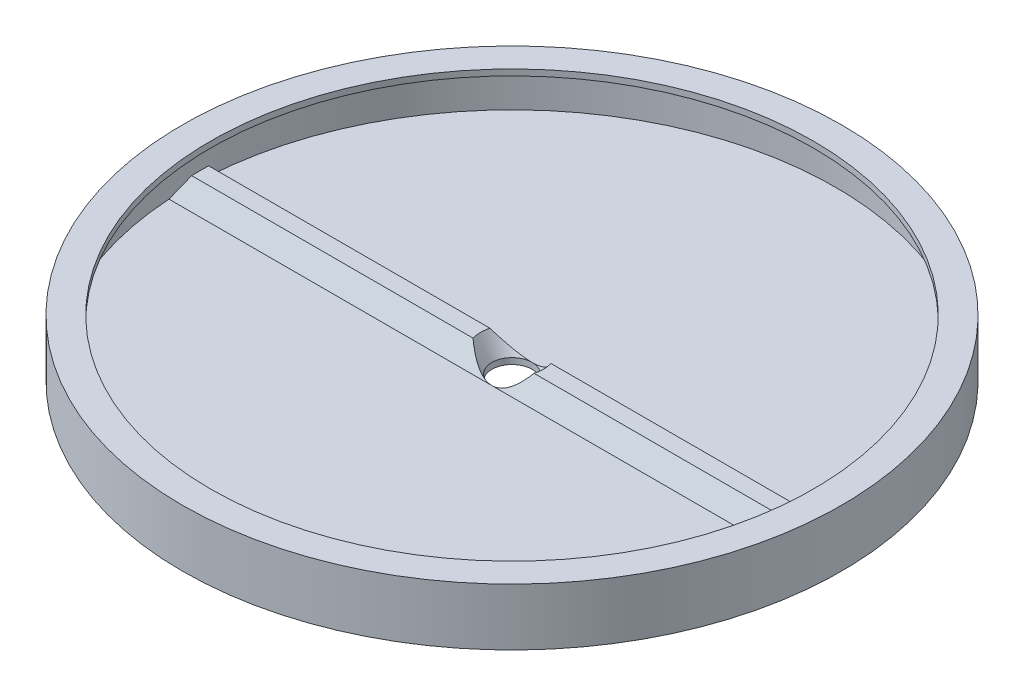
from build123d import *

# Parameters (mm, degrees)
SKETCH2_R             = 80.5
SKETCH2_R_2           = 5
BOSS_EXTRUDE1_DEPTH   = 1.5
BOSS_EXTRUDE3_DEPTH   = 5
BOSS_EXTRUDE3_DRAFT   = 30
BOSS_EXTRUDE3_2_DEPTH = 5
BOSS_EXTRUDE3_2_DRAFT = 30
BOSS_EXTRUDE4_DEPTH   = 7.5
SKETCH8_R             = 2
CUT_EXTRUDE1_DEPTH    = 3


# Read off the part's stored shape, not the designer's step: Boss-Extrude3
with BuildPart() as part:
    # Sketch2 → Boss-Extrude1 (new body)
    with BuildSketch(Plane(origin=(0, 0, 0), x_dir=(1, 0, 0), z_dir=(0, 1, 0))):
        with Locations(Location((0, 0, 0), (0, 0, 270))):
            Circle(SKETCH2_R)
        with Locations(Location((0, 0, 0), (0, 0, 270))):
            Circle(SKETCH2_R_2, mode=Mode.SUBTRACT)
    extrude(amount=BOSS_EXTRUDE1_DEPTH)


with BuildPart() as boss_extrude3_tool:
    # Boss-Extrude3 outline → Boss-Extrude3 (with draft: the straight prism first)
    with BuildSketch(Plane(origin=(0, 6.5, 0), x_dir=(1, 0, 0), z_dir=(0, 1, 0))):
        with BuildLine():
            Line((-7.598356857, 2.113248654), (-77.584473619, 2.113248654))
            ThreePointArc((-77.584473619, 2.113248654), (-77.613248654, 0), (-77.584473619, -2.113248654))
            Line((-77.584473619, -2.113248654), (-7.598356857, -2.113248654))
            ThreePointArc((-7.598356857, -2.113248654), (-7.886751346, 0), (-7.598356857, 2.113248654))
        make_face()
    extrude(amount=-BOSS_EXTRUDE3_DEPTH)
    # Boss-Extrude3: the draft: its side faces are tilted about the plane it starts from
    boss_extrude3_sides = [boss_extrude3_tool.faces().sort_by_distance(p)[0] for p in [
        (-42.591415238, 4, -2.113248654),
        (-77.613248654, 4, 0),
        (-42.591415238, 4, 2.113248654),
        (-7.886751346, 4, 0),
    ]]
    draft(boss_extrude3_sides, Plane(origin=(0, 6.5, 0), x_dir=(1, 0, 0), z_dir=(0, 1, 0)), BOSS_EXTRUDE3_DRAFT)


with BuildPart() as part_1:
    add(part.part)

    # Boss-Extrude3: add boss_extrude3_tool
    add(boss_extrude3_tool.part)


with BuildPart() as boss_extrude3_2_tool:
    # Boss-Extrude3 2 outline → Boss-Extrude3 2 (with draft: the straight prism first)
    with BuildSketch(Plane(origin=(0, 6.5, 0), x_dir=(1, 0, 0), z_dir=(0, 1, 0))):
        with BuildLine():
            Line((77.584473619, 2.113248654), (7.598356857, 2.113248654))
            ThreePointArc((7.598356857, 2.113248654), (7.886751346, 0), (7.598356857, -2.113248654))
            Line((7.598356857, -2.113248654), (77.584473619, -2.113248654))
            ThreePointArc((77.584473619, -2.113248654), (77.613248654, 0), (77.584473619, 2.113248654))
        make_face()
    extrude(amount=-BOSS_EXTRUDE3_2_DEPTH)
    # Boss-Extrude3 2: the draft: its side faces are tilted about the plane it starts from
    boss_extrude3_2_sides = [boss_extrude3_2_tool.faces().sort_by_distance(p)[0] for p in [
        (42.591415238, 4, 2.113248654),
        (77.613248654, 4, 0),
        (42.591415238, 4, -2.113248654),
        (7.886751346, 4, 0),
    ]]
    draft(boss_extrude3_2_sides, Plane(origin=(0, 6.5, 0), x_dir=(1, 0, 0), z_dir=(0, 1, 0)), BOSS_EXTRUDE3_2_DRAFT)


with BuildPart() as part_2:
    add(part_1.part)

    # Boss-Extrude3 2: add boss_extrude3_2_tool
    add(boss_extrude3_2_tool.part)

    # Sketch6 → Revolve1 (revolve)
    with BuildSketch(Plane.XY, mode=Mode.PRIVATE) as revolve1_sk:
        Polygon((-80.5, 0), (-82, 0), (-82, 14.2), (-75, 14.2), (-75, 12.7), (-80.5, 12.7), align=None)
    revolve(revolve1_sk.sketch.rotate(Axis((0, 13, 0), (0, -1, 0)), 270), axis=Axis((0, 13, 0), (0, -1, 0)))

    # Sketch7 → Boss-Extrude4 (add)
    with BuildSketch(Plane.XZ):
        with BuildLine():
            Line((10.405859981, 10), (14.903696288, 10))
            ThreePointArc((14.903696288, 10), (16.317909851, 9.414213562), (16.903696288, 8))
            Line((16.903696288, 8), (16.903696288, -8))
            ThreePointArc((16.903696288, -8), (16.317909851, -9.414213562), (14.903696288, -10))
            Line((14.903696288, -10), (10.405859981, -10))
            Line((10.405859981, -10), (10.405859981, 10))
        make_face()
        with BuildLine():
            Line((-30.594140019, -10), (-35.091976326, -10))
            ThreePointArc((-35.091976326, -10), (-36.506189888, -9.414213562), (-37.091976326, -8))
            Line((-37.091976326, -8), (-37.091976326, 8))
            ThreePointArc((-37.091976326, 8), (-36.506189888, 9.414213562), (-35.091976326, 10))
            Line((-35.091976326, 10), (-30.594140019, 10))
            Line((-30.594140019, 10), (-30.594140019, -10))
        make_face()
    extrude(amount=BOSS_EXTRUDE4_DEPTH)

    # Sketch8 → Cut-Extrude1 (cut)
    with BuildSketch(Plane.XZ.offset(7.5)):
        with Locations(Location((13.905859981, -5, 0), (0, 0, 270))):
            Circle(SKETCH8_R)
        with Locations(Location((13.905859981, 5, 0), (0, 0, 270))):
            Circle(SKETCH8_R)
        with Locations(Location((-34.094140019, -5, 0), (0, 0, 270))):
            Circle(SKETCH8_R)
        with Locations(Location((-34.094140019, 5, 0), (0, 0, 270))):
            Circle(SKETCH8_R)
    extrude(amount=-CUT_EXTRUDE1_DEPTH, mode=Mode.SUBTRACT)


solid = part_2.part
